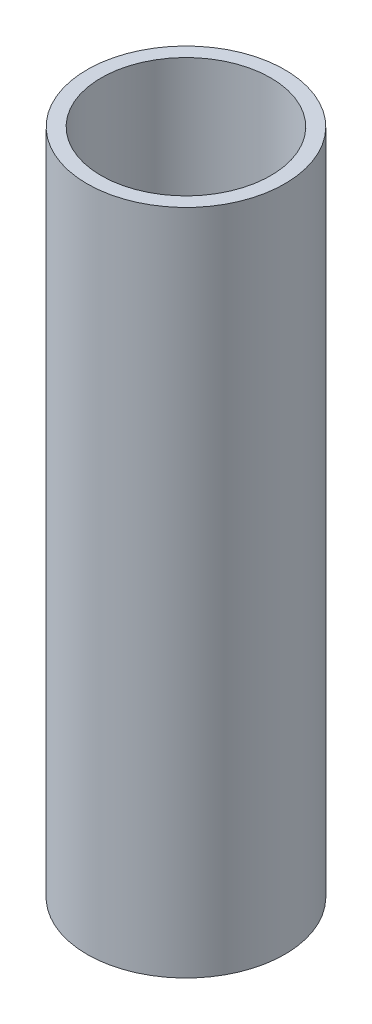
from build123d import *

# Parameters (mm, degrees)
SKETCH1_R           = 22.225
SKETCH1_R_2         = 19.05
BOSS_EXTRUDE1_DEPTH = 150


with BuildPart() as part:
    # Sketch1 → Boss-Extrude1 (new body)
    with BuildSketch(Plane(origin=(0, 0, 0), x_dir=(1, 0, 0), z_dir=(0, 1, 0))):
        Circle(SKETCH1_R)
        Circle(SKETCH1_R_2, mode=Mode.SUBTRACT)
    extrude(amount=BOSS_EXTRUDE1_DEPTH)


solid = part.part
